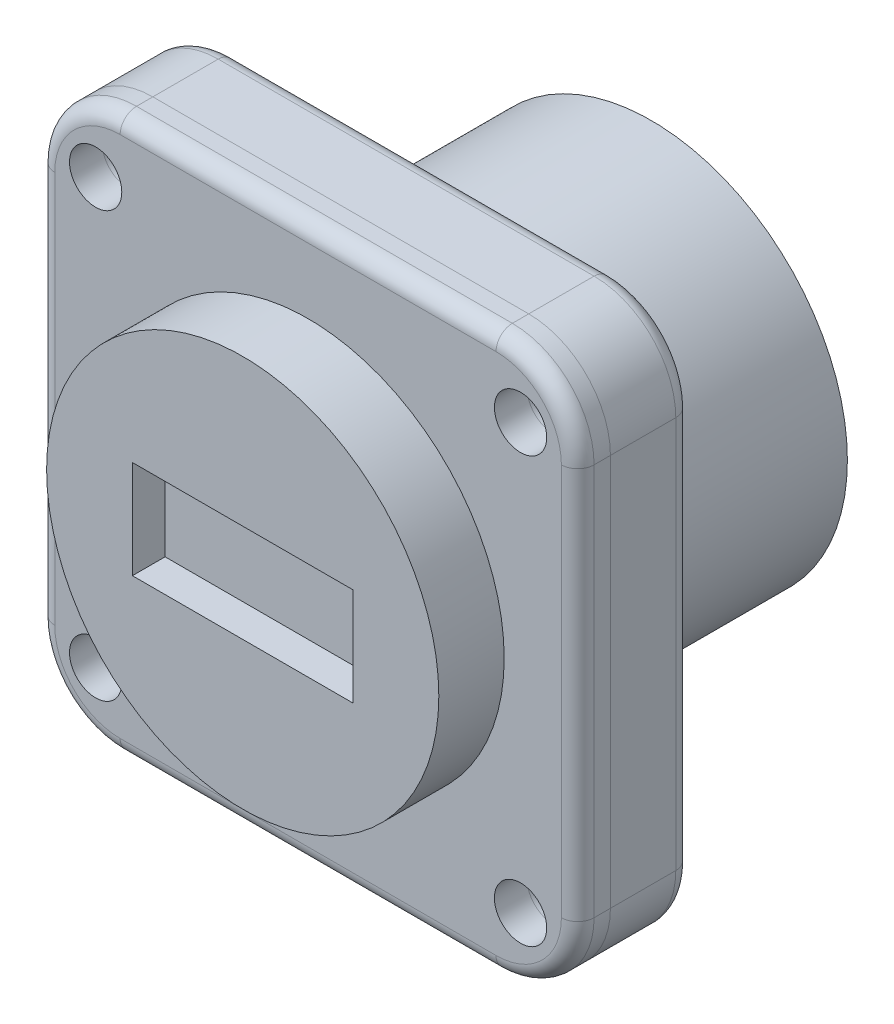
from build123d import *

# Parameters (mm, degrees)
SKETCH1_W                = 33
SKETCH1_H                = 34
SKETCH1_R                = 12
SKETCH1_R_2              = 1.6
BOSS_EXTRUDE1_DEPTH      = 5
FILLET1_R                = 5
BOSS_EXTRUDE2_DEPTH      = 14
BOSS_EXTRUDE2_DEPTH_BACK = 5
SKETCH2_R                = 12
SKETCH3_R                = 1.6
BOSS_EXTRUDE3_DEPTH      = 2
FILLET2_R                = 1
FILLET3_R                = 1
CHAMFER1_SIZE            = 1
BOSS_EXTRUDE4_START      = 4
SKETCH4_R                = 12
BOSS_EXTRUDE4_DEPTH      = 4
SKETCH5_R                = 11.071904539
CUT_EXTRUDE1_DEPTH       = 4
SKETCH6_W                = 13.5
SKETCH6_H                = 6
CUT_EXTRUDE2_DEPTH       = 2
SKETCH7_W                = 13.5
SKETCH7_H                = 6
CUT_EXTRUDE3_DEPTH       = 10


with BuildPart() as part:
    # Sketch1 → Boss-Extrude1 (new body)
    with BuildSketch(Plane.XY):
        Rectangle(SKETCH1_W, SKETCH1_H)
        Circle(SKETCH1_R, mode=Mode.SUBTRACT)
        with Locations((-13, 13)):
            Circle(SKETCH1_R_2, mode=Mode.SUBTRACT)
        with Locations((13, -13)):
            Circle(SKETCH1_R_2, mode=Mode.SUBTRACT)
        with Locations(Location((13, 13, 0), (0, 0, 180))):
            Circle(SKETCH1_R_2, mode=Mode.SUBTRACT)
        with Locations(Location((-13, -13, 0), (0, 0, 180))):
            Circle(SKETCH1_R_2, mode=Mode.SUBTRACT)
    extrude(amount=BOSS_EXTRUDE1_DEPTH)

    # Fillet1
    fillet1_edges = [part.edges().sort_by_distance(p)[0] for p in [
        (16.5, -17, 2.5),
        (-16.5, -17, 2.5),
        (-16.5, 17, 2.5),
        (16.5, 17, 2.5),
    ]]
    fillet(fillet1_edges, radius=FILLET1_R)

    # Sketch2 → Boss-Extrude2 (add, two sides: drawn at the far end of the back side and taken through both)
    with BuildSketch(Plane(origin=(0, 0, 0), x_dir=(-1, 0, 0), z_dir=(0, 0, -1)).offset(-BOSS_EXTRUDE2_DEPTH_BACK)):
        Circle(SKETCH2_R)
    extrude(amount=BOSS_EXTRUDE2_DEPTH + BOSS_EXTRUDE2_DEPTH_BACK)

    # Fillet2
    fillet2_edges = [part.edges().sort_by_distance(p)[0] for p in [
        (-16.5, 0, 0),
        (16.5, 0, 0),
        (0, -17, 0),
        (0, 17, 0),
        (15.035533906, 15.535533906, 0),
        (15.035533906, -15.535533906, 0),
        (-15.035533906, -15.535533906, 0),
        (-15.035533906, 15.535533906, 0),
    ]]
    fillet(fillet2_edges, radius=FILLET2_R)

    # Chamfer1
    # the kernel refuses this chamfer: 1 mm, written as the material it takes off along each edge
    with BuildSketch(Plane(origin=(-13, 13, 0), x_dir=(1, 0, 0), z_dir=(0, -1, 0))) as chamfer1_piece_1:
        Polygon((1.6 + CHAMFER1_SIZE, 0), (1.6, CHAMFER1_SIZE), (1.6, 0), align=None)
    revolve(axis=Axis((-13, 13, 0), (0, 0, 1)), mode=Mode.SUBTRACT)
    with BuildSketch(Plane(origin=(13, -13, 0), x_dir=(1, 0, 0), z_dir=(0, -1, 0))) as chamfer1_piece_2:
        Polygon((1.6 + CHAMFER1_SIZE, 0), (1.6, CHAMFER1_SIZE), (1.6, 0), align=None)
    revolve(axis=Axis((13, -13, 0), (0, 0, 1)), mode=Mode.SUBTRACT)
    with BuildSketch(Plane(origin=(13, 13, 0), x_dir=(-1, 0, 0), z_dir=(0, 1, 0))) as chamfer1_piece_3:
        Polygon((1.6 + CHAMFER1_SIZE, 0), (1.6, CHAMFER1_SIZE), (1.6, 0), align=None)
    revolve(axis=Axis((13, 13, 0), (0, 0, 1)), mode=Mode.SUBTRACT)
    with BuildSketch(Plane(origin=(-13, -13, 0), x_dir=(-1, 0, 0), z_dir=(0, 1, 0))) as chamfer1_piece_4:
        Polygon((1.6 + CHAMFER1_SIZE, 0), (1.6, CHAMFER1_SIZE), (1.6, 0), align=None)
    revolve(axis=Axis((-13, -13, 0), (0, 0, 1)), mode=Mode.SUBTRACT)

    # Sketch5 → Cut-Extrude1 (cut)
    with BuildSketch(Plane(origin=(0, 0, -14), x_dir=(-1, 0, 0), z_dir=(0, 0, -1))):
        Circle(SKETCH5_R)
    extrude(amount=-CUT_EXTRUDE1_DEPTH, mode=Mode.SUBTRACT)

    # Sketch7 → Cut-Extrude3 (cut)
    with BuildSketch(Plane(origin=(0, 0, -10), x_dir=(-1, 0, 0), z_dir=(0, 0, -1))):
        Rectangle(SKETCH7_W, SKETCH7_H)
    extrude(amount=-CUT_EXTRUDE3_DEPTH, mode=Mode.SUBTRACT)


with BuildPart() as body_2:
    # Sketch3 → Boss-Extrude3 (new body)
    with BuildSketch(Plane.XY.offset(5)):
        with BuildLine():
            Line((-11.5, -17), (11.5, -17))
            ThreePointArc((11.5, -17), (15.035533906, -15.535533906), (16.5, -12))
            Line((16.5, -12), (16.5, 12))
            ThreePointArc((16.5, 12), (15.035533906, 15.535533906), (11.5, 17))
            Line((11.5, 17), (-11.5, 17))
            ThreePointArc((-11.5, 17), (-15.035533906, 15.535533906), (-16.5, 12))
            Line((-16.5, 12), (-16.5, -12))
            ThreePointArc((-16.5, -12), (-15.035533906, -15.535533906), (-11.5, -17))
        make_face()
        with Locations((-13, 13)):
            Circle(SKETCH3_R, mode=Mode.SUBTRACT)
        with Locations((13, 13)):
            Circle(SKETCH3_R, mode=Mode.SUBTRACT)
        with Locations((13, -13)):
            Circle(SKETCH3_R, mode=Mode.SUBTRACT)
        with Locations((-13, -13)):
            Circle(SKETCH3_R, mode=Mode.SUBTRACT)
    extrude(amount=BOSS_EXTRUDE3_DEPTH)

    # Fillet3
    fillet3_edges = [body_2.edges().sort_by_distance(p)[0] for p in [
        (15.035533906, -15.535533906, 7),
        (16.5, 0, 7),
        (15.035533906, 15.535533906, 7),
        (0, 17, 7),
        (-15.035533906, 15.535533906, 7),
        (-16.5, 0, 7),
        (-15.035533906, -15.535533906, 7),
        (0, -17, 7),
    ]]
    fillet(fillet3_edges, radius=FILLET3_R)

    # Sketch4 → Boss-Extrude4 (add)
    with BuildSketch(Plane.XY.offset(7).offset(BOSS_EXTRUDE4_START)):
        Circle(SKETCH4_R)
    extrude(amount=-BOSS_EXTRUDE4_DEPTH)

    # Sketch6 → Cut-Extrude2 (cut)
    with BuildSketch(Plane.XY.offset(11)):
        Rectangle(SKETCH6_W, SKETCH6_H)
    extrude(amount=-CUT_EXTRUDE2_DEPTH, mode=Mode.SUBTRACT)


solid = Compound([part.part, body_2.part])
